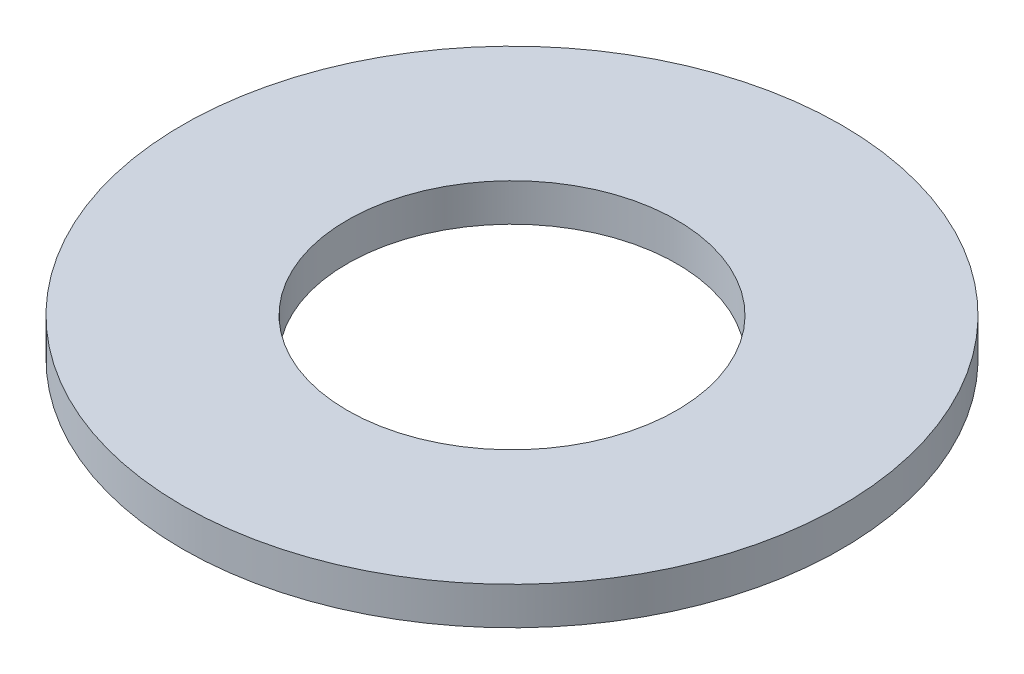
from build123d import *

# Parameters (mm, degrees)
SKETCH1_R           = 35
BOSS_EXTRUDE1_DEPTH = 4
SKETCH2_R           = 17.5
CUT_EXTRUDE1_DEPTH  = 50.658836072


with BuildPart() as part:
    # Sketch1 → Boss-Extrude1 (new body)
    with BuildSketch(Plane(origin=(0, 0, 0), x_dir=(1, 0, 0), z_dir=(0, 1, 0))):
        Circle(SKETCH1_R)
    extrude(amount=BOSS_EXTRUDE1_DEPTH)

    # Sketch2 → Cut-Extrude1 (cut, through all)
    with BuildSketch(Plane(origin=(0, 0, 0), x_dir=(1, 0, 0), z_dir=(0, 1, 0))):
        Circle(SKETCH2_R)
    extrude(amount=CUT_EXTRUDE1_DEPTH, mode=Mode.SUBTRACT)


solid = part.part
